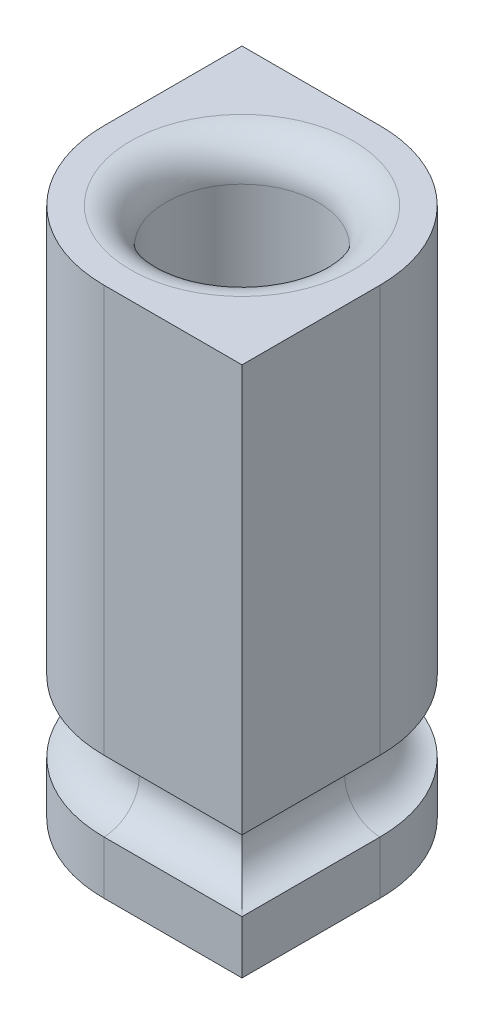
from build123d import *

# Parameters (mm, degrees)
BOSS_EXTRUDE1_DEPTH     = 5
CUT_EXTRUDE2_DEPTH      = 1
CUT_EXTRUDE2_DEPTH_BACK = 1
FILLET1_R               = 1
SKETCH4_R               = 2.15
BOSS_EXTRUDE3_DEPTH     = 10
FILLET2_R               = 1


with BuildPart() as part:
    # Sketch1 → Boss-Extrude1 (new body)
    with BuildSketch(Plane(origin=(0, 0, 0), x_dir=(1, 0, 0), z_dir=(0, 1, 0))):
        with BuildLine():
            Line((-3.9, 3.9), (0, 3.9))
            ThreePointArc((0, 3.9), (2.757716447, 2.757716447), (3.9, 0))
            Line((3.9, 0), (3.9, -3.9))
            Line((3.9, -3.9), (0, -3.9))
            ThreePointArc((0, -3.9), (-2.757716447, -2.757716447), (-3.9, 0))
            Line((-3.9, 0), (-3.9, 3.9))
        make_face()
    extrude(amount=BOSS_EXTRUDE1_DEPTH)

    # Sketch3 → Cut-Extrude2 (cut, two sides: drawn at the far end of the back side and taken through both)
    with BuildSketch(Plane(origin=(0, 2.5, 0), x_dir=(1, 0, 0), z_dir=(0, 1, 0)).offset(-CUT_EXTRUDE2_DEPTH_BACK)):
        with BuildLine():
            Line((-3.9, 0), (-3.9, 3.9))
            Line((-3.9, 3.9), (0, 3.9))
            ThreePointArc((0, 3.9), (2.757716447, 2.757716447), (3.9, 0))
            Line((3.9, 0), (3.9, -3.9))
            Line((3.9, -3.9), (0, -3.9))
            ThreePointArc((0, -3.9), (-2.757716447, -2.757716447), (-3.9, 0))
        make_face()
        with BuildLine():
            Line((-2.9, 0), (-2.9, 2.9))
            Line((-2.9, 2.9), (0, 2.9))
            ThreePointArc((0, 2.9), (2.050609665, 2.050609665), (2.9, 0))
            Line((2.9, 0), (2.9, -2.9))
            Line((2.9, -2.9), (0, -2.9))
            ThreePointArc((0, -2.9), (-2.050609665, -2.050609665), (-2.9, 0))
        make_face(mode=Mode.SUBTRACT)
    extrude(amount=CUT_EXTRUDE2_DEPTH + CUT_EXTRUDE2_DEPTH_BACK, mode=Mode.SUBTRACT)

    # Fillet1
    fillet1_edges = [part.edges().sort_by_distance(p)[0] for p in [
        (2.9, 3.5, 1.45),
        (2.050609665, 3.5, -2.050609665),
        (1.45, 3.5, 2.9),
        (-2.050609665, 3.5, 2.050609665),
        (2.9, 1.5, 1.45),
        (2.050609665, 1.5, -2.050609665),
        (-2.9, 1.5, -1.45),
        (1.45, 1.5, 2.9),
        (-1.45, 3.5, -2.9),
        (-2.9, 3.5, -1.45),
        (-1.45, 1.5, -2.9),
        (-2.050609665, 1.5, 2.050609665),
    ]]
    fillet(fillet1_edges, radius=FILLET1_R - 0.0001)  # a hair under: the kernel refuses the full size

    # Sketch4 → Boss-Extrude3 (add)
    with BuildSketch(Plane(origin=(0, 5, 0), x_dir=(1, 0, 0), z_dir=(0, 1, 0))):
        with BuildLine():
            Line((0, 3.9), (-3.9, 3.9))
            Line((-3.9, 3.9), (-3.9, 0))
            ThreePointArc((-3.9, 0), (-2.757716447, -2.757716447), (0, -3.9))
            Line((0, -3.9), (3.9, -3.9))
            Line((3.9, -3.9), (3.9, 0))
            ThreePointArc((3.9, 0), (2.757716447, 2.757716447), (0, 3.9))
        make_face()
        with Locations(Location((0, 0, 0), (0, 0, 270))):
            Circle(SKETCH4_R, mode=Mode.SUBTRACT)
    extrude(amount=BOSS_EXTRUDE3_DEPTH)

    # Fillet2
    fillet2_edges = [part.edges().sort_by_distance(p)[0] for p in [
        (0, 15, -2.15),
    ]]
    fillet(fillet2_edges, radius=FILLET2_R)


solid = part.part
